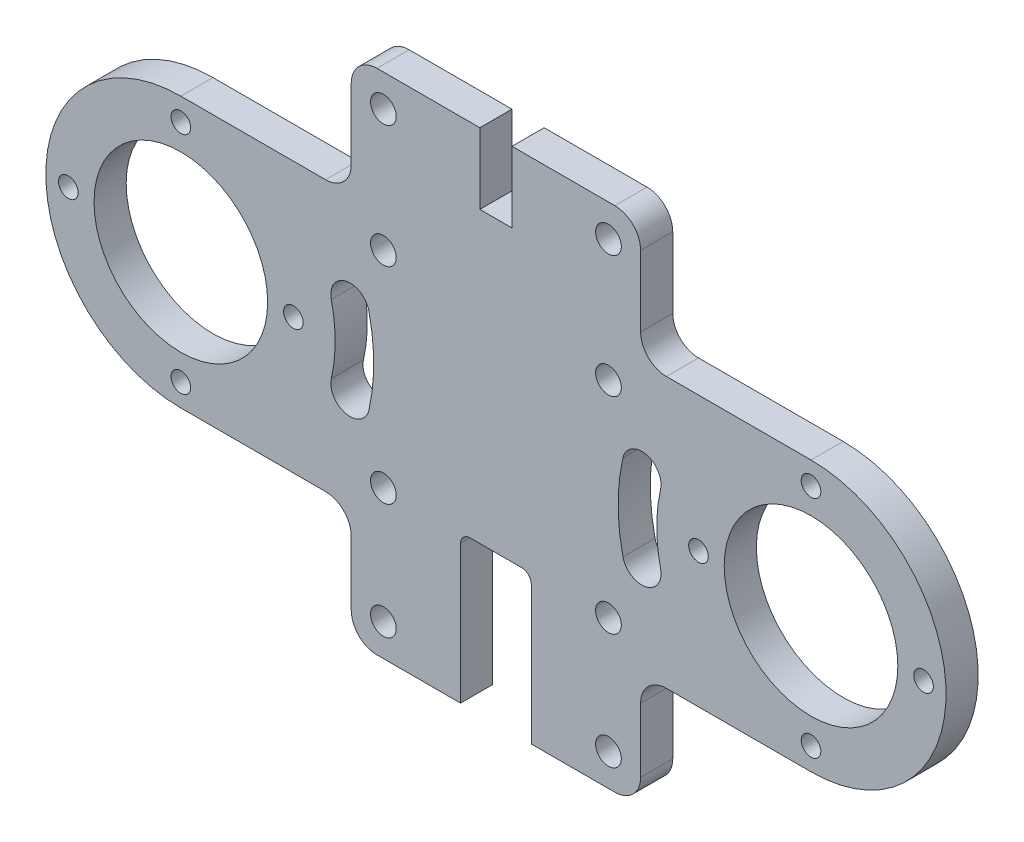
from build123d import *

# Parameters (mm, degrees)
SKETCH1_R           = 1.5
SKETCH1_R_2         = 13
BOSS_EXTRUDE1_DEPTH = 5
SKETCH2_R           = 13.5
CUT_EXTRUDE1_DEPTH  = 10
CUT_EXTRUDE2_DEPTH  = 10
SKETCH4_W           = 11
SKETCH4_H           = 5
CUT_EXTRUDE3_DEPTH  = 82
FILLET1_R           = 1.5
BOSS_EXTRUDE2_START = -5
SKETCH5_R           = 2
BOSS_EXTRUDE2_DEPTH = 5
FILLET2_R           = 4
SKETCH6_R           = 2
CUT_EXTRUDE4_DEPTH  = 5
SKETCH7_R           = 1.525
CUT_EXTRUDE5_DEPTH  = 10


with BuildPart() as part:
    # Sketch1 → Boss-Extrude1 (new body)
    with BuildSketch(Plane.XY):
        with BuildLine():
            Line((-49, 26), (49, 26))
            ThreePointArc((49, 26), (70, 5), (49, -16))
            Line((49, -16), (-49, -16))
            ThreePointArc((-49, -16), (-70, 5), (-49, 26))
        make_face()
        with Locations((49, -12.5)):
            Circle(SKETCH1_R, mode=Mode.SUBTRACT)
        with Locations((66.5, 5)):
            Circle(SKETCH1_R, mode=Mode.SUBTRACT)
        with Locations((31.5, 5)):
            Circle(SKETCH1_R, mode=Mode.SUBTRACT)
        with Locations((49, 22.5)):
            Circle(SKETCH1_R, mode=Mode.SUBTRACT)
        with Locations((-49, -12.5)):
            Circle(SKETCH1_R, mode=Mode.SUBTRACT)
        with Locations((-31.5, 5)):
            Circle(SKETCH1_R, mode=Mode.SUBTRACT)
        with Locations((-66.5, 5)):
            Circle(SKETCH1_R, mode=Mode.SUBTRACT)
        with Locations((-49, 22.5)):
            Circle(SKETCH1_R, mode=Mode.SUBTRACT)
        with Locations((-49, 5)):
            Circle(SKETCH1_R_2, mode=Mode.SUBTRACT)
        with Locations((49, 5)):
            Circle(SKETCH1_R_2, mode=Mode.SUBTRACT)
    extrude(amount=BOSS_EXTRUDE1_DEPTH)

    # Sketch2 → Cut-Extrude1 (cut)
    with BuildSketch(Plane(origin=(0, 0, 0), x_dir=(-1, 0, 0), z_dir=(0, 0, -1))):
        with Locations((-49, 5)):
            Circle(SKETCH2_R)
        with Locations((49, 5)):
            Circle(SKETCH2_R)
    extrude(amount=-CUT_EXTRUDE1_DEPTH, mode=Mode.SUBTRACT)

    # Sketch3 → Cut-Extrude2 (cut)
    with BuildSketch(Plane.XY.offset(5)):
        with BuildLine():
            ThreePointArc((25.600094967, -0.333333333), (25, 5), (25.600094967, 10.333333333))
            ThreePointArc((25.600094967, 10.333333333), (23.341773504, 13.924988129), (19.750118709, 11.666666667))
            ThreePointArc((19.750118709, 11.666666667), (19, 5), (19.750118709, -1.666666667))
            ThreePointArc((19.750118709, -1.666666667), (23.341773504, -3.924988129), (25.600094967, -0.333333333))
        make_face()
        with BuildLine():
            ThreePointArc((-25.600094967, -0.333333333), (-23.341773504, -3.924988129), (-19.750118709, -1.666666667))
            ThreePointArc((-19.750118709, -1.666666667), (-19, 5), (-19.750118709, 11.666666667))
            ThreePointArc((-19.750118709, 11.666666667), (-23.341773504, 13.924988129), (-25.600094967, 10.333333333))
            ThreePointArc((-25.600094967, 10.333333333), (-25, 5), (-25.600094967, -0.333333333))
        make_face()
    extrude(amount=-CUT_EXTRUDE2_DEPTH, mode=Mode.SUBTRACT)

    # Sketch4 → Cut-Extrude3 (cut)
    with BuildSketch(Plane(origin=(0, 0, 0), x_dir=(-1, 0, 0), z_dir=(0, 0, -1))):
        with Locations((0, -13.5)):
            Rectangle(SKETCH4_W, SKETCH4_H)
    extrude(amount=-CUT_EXTRUDE3_DEPTH, mode=Mode.SUBTRACT)

    # Fillet1
    fillet1_edges = [part.edges().sort_by_distance(p)[0] for p in [
        (-5.5, -11, 2.5),
        (5.5, -11, 2.5),
    ]]
    fillet(fillet1_edges, radius=FILLET1_R)

    # Sketch5 → Boss-Extrude2 (add)
    with BuildSketch(Plane(origin=(0, 0, 0), x_dir=(-1, 0, 0), z_dir=(0, 0, -1)).offset(BOSS_EXTRUDE2_START)):
        with BuildLine():
            Line((-2.5, 44.999998267), (-22.5, 44.999998267))
            Line((-22.5, 44.999998267), (-22.5, 13.994885239))
            ThreePointArc((-22.5, 13.994885239), (-20.736602871, 13.289585633), (-19.750118709, 11.666666667))
            ThreePointArc((-19.750118709, 11.666666667), (-19, 5), (-19.750118709, -1.666666667))
            ThreePointArc((-19.750118709, -1.666666667), (-20.736602871, -3.289585633), (-22.5, -3.994885239))
            Line((-22.5, -3.994885239), (-22.5, -34))
            Line((-22.5, -34), (-5.5, -34))
            Line((-5.5, -34), (-5.5, -12.5))
            ThreePointArc((-5.5, -12.5), (-5.060660172, -11.439339828), (-4, -11))
            Line((-4, -11), (4, -11))
            ThreePointArc((4, -11), (5.060660172, -11.439339828), (5.5, -12.5))
            Line((5.5, -12.5), (5.5, -34))
            Line((5.5, -34), (22.5, -34))
            Line((22.5, -34), (22.5, -3.994885239))
            ThreePointArc((22.5, -3.994885239), (20.736602871, -3.289585633), (19.750118709, -1.666666667))
            ThreePointArc((19.750118709, -1.666666667), (19, 5), (19.750118709, 11.666666667))
            ThreePointArc((19.750118709, 11.666666667), (20.736602871, 13.289585633), (22.5, 13.994885239))
            Line((22.5, 13.994885239), (22.5, 44.999998267))
            Line((22.5, 44.999998267), (2.5, 44.999998267))
            Line((2.5, 44.999998267), (2.5, 33.999998267))
            Line((2.5, 33.999998267), (-2.5, 33.999998267))
            Line((-2.5, 33.999998267), (-2.5, 44.999998267))
        make_face()
        with Locations((-17.5, 39.999998267)):
            Circle(SKETCH5_R, mode=Mode.SUBTRACT)
        with Locations((17.5, 39.999998267)):
            Circle(SKETCH5_R, mode=Mode.SUBTRACT)
        with Locations((17.5, -29)):
            Circle(SKETCH5_R, mode=Mode.SUBTRACT)
        with Locations((-17.5, -29)):
            Circle(SKETCH5_R, mode=Mode.SUBTRACT)
    extrude(amount=BOSS_EXTRUDE2_DEPTH)

    # Fillet2
    fillet2_edges = [part.edges().sort_by_distance(p)[0] for p in [
        (-22.5, -34, 2.5),
        (-22.5, -16, 2.5),
        (22.5, -34, 2.5),
        (22.5, -16, 2.5),
        (22.5, 44.999998267, 2.5),
        (-22.5, 44.999998267, 2.5),
        (-22.5, 26, 2.5),
        (22.5, 26, 2.5),
    ]]
    fillet(fillet2_edges, radius=FILLET2_R)

    # Sketch6 → Cut-Extrude4 (cut)
    with BuildSketch(Plane(origin=(0, 0, 0), x_dir=(-1, 0, 0), z_dir=(0, 0, -1))):
        with Locations((-17.5, 21)):
            Circle(SKETCH6_R)
        with Locations((17.5, 21)):
            Circle(SKETCH6_R)
        with Locations((-17.5, -11)):
            Circle(SKETCH6_R)
        with Locations((17.5, -11)):
            Circle(SKETCH6_R)
    extrude(amount=-CUT_EXTRUDE4_DEPTH, mode=Mode.SUBTRACT)

    # Sketch7 → Cut-Extrude5 (cut)
    with BuildSketch(Plane.XY.offset(5)):
        with Locations((-49, 22.5)):
            Circle(SKETCH7_R)
        with Locations((-66.5, 5)):
            Circle(SKETCH7_R)
        with Locations((-31.5, 5)):
            Circle(SKETCH7_R)
        with Locations((-49, -12.5)):
            Circle(SKETCH7_R)
        with Locations((49, 22.5)):
            Circle(SKETCH7_R)
        with Locations((31.5, 5)):
            Circle(SKETCH7_R)
        with Locations((66.5, 5)):
            Circle(SKETCH7_R)
        with Locations((49, -12.5)):
            Circle(SKETCH7_R)
    extrude(amount=-CUT_EXTRUDE5_DEPTH, mode=Mode.SUBTRACT)


solid = part.part
